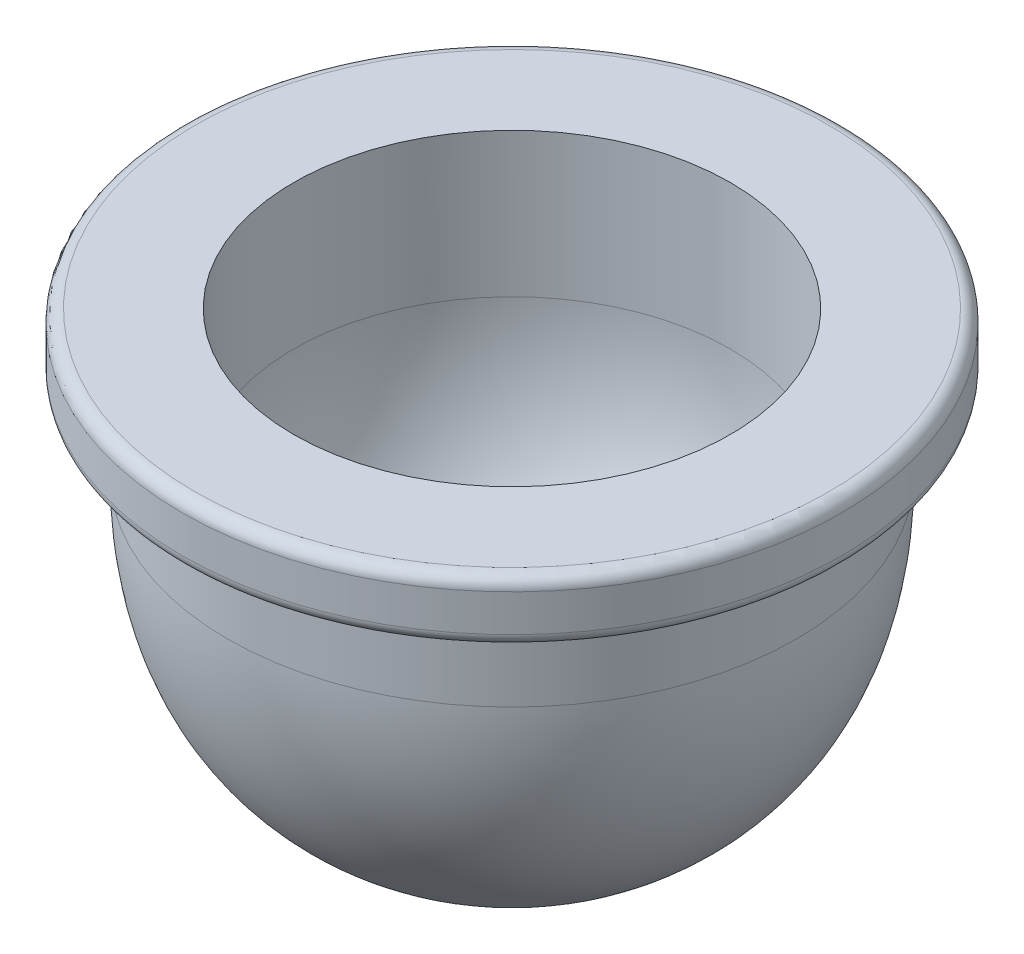
from build123d import *

# Parameters (mm, degrees)
FILLET2_R = 0.3


with BuildPart() as part:
    # Sketch1 → Revolve2 (revolve)
    with BuildSketch(Plane.XY):
        with BuildLine():
            Line((6.9, -1.5), (6.899999986, -3.5))
            add(Edge.make_bspline(
                [(6.899999986, -3.5), (6.899999986, -8.642671537), (3.39705755, -11), (0, -11)],
                knots=[0, 0, 0, 0, 1, 1, 1, 1], degree=3))
            Line((0, -11), (0, -9.4))
            add(Edge.make_bspline(
                [(5.299999986, -3.5), (5.299999986, -3.763874155), (5.276508791, -4.308490266), (5.145776343, -5.256949984), (4.84442019, -6.283573568), (4.31283462, -7.266467964), (3.420388298, -8.306429895), (2.003224285, -9.166050578), (0.660558855, -9.4), (0, -9.4)],
                knots=[0, 0, 0, 0, 0.0625, 0.125, 0.25, 0.375, 0.5, 0.75, 1, 1, 1, 1], degree=3))
            Line((5.299999986, -3.5), (5.3, 0))
            Line((5.3, 0), (8, 0))
            Line((8, 0), (8, -1.5))
            Line((8, -1.5), (6.9, -1.5))
        make_face()
    revolve(axis=Axis((0, -11, 0), (0, 1, 0)))

    # Fillet2
    fillet2_edges = [part.edges().sort_by_distance(p)[0] for p in [
        (-8, -1.5, 0),
        (-8, 0, 0),
    ]]
    fillet(fillet2_edges, radius=FILLET2_R)


solid = part.part
